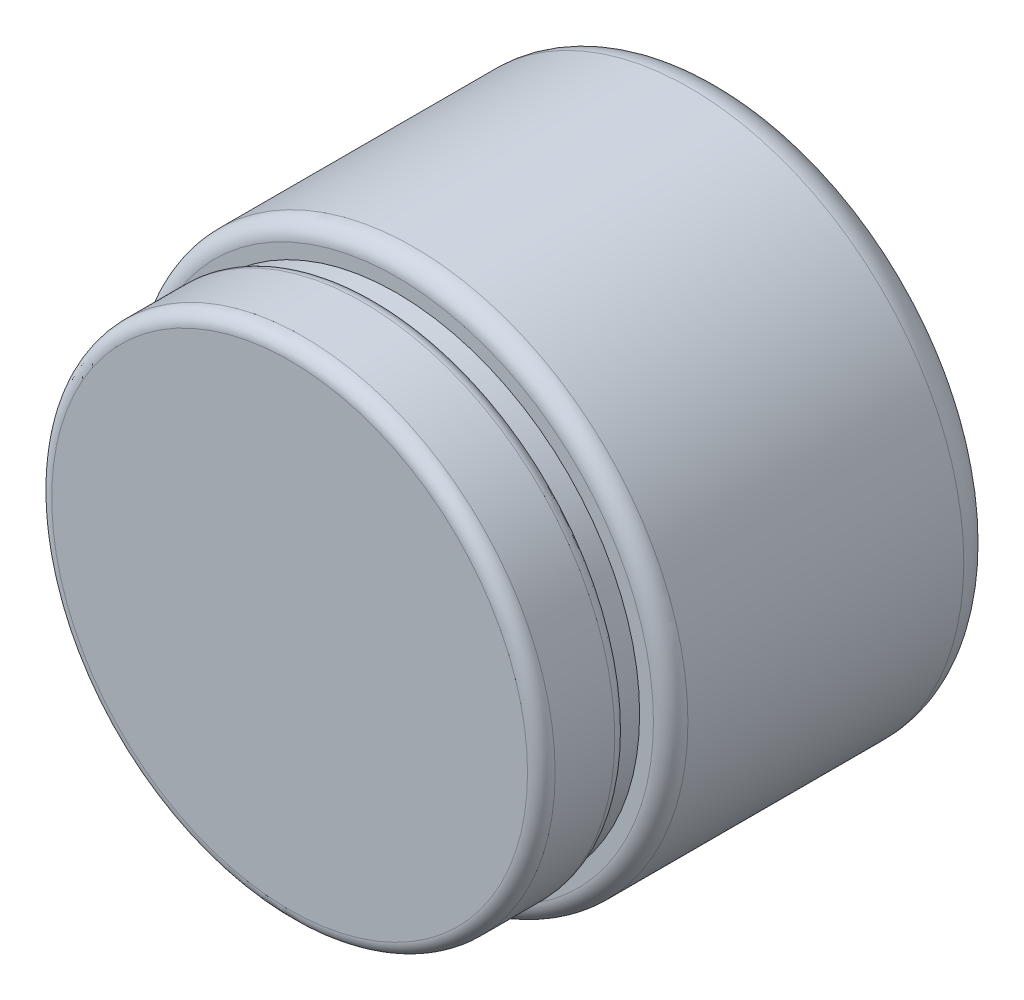
from build123d import *

# Parameters (mm, degrees)
SKETCH1_R           = 37.084
BOSS_EXTRUDE1_DEPTH = 12.7
SKETCH2_R           = 35.814
BOSS_EXTRUDE2_DEPTH = 3.048
SKETCH3_R           = 40.386
BOSS_EXTRUDE3_DEPTH = 48.26
FILLET1_R           = 2.54
FILLET2_R           = 5.08
FILLET3_R           = 2.032


with BuildPart() as part:
    # Sketch1 → Boss-Extrude1 (new body)
    with BuildSketch(Plane.XY):
        Circle(SKETCH1_R)
    extrude(amount=BOSS_EXTRUDE1_DEPTH)

    # Sketch2 → Boss-Extrude2 (add)
    with BuildSketch(Plane(origin=(0, 0, 0), x_dir=(-1, 0, 0), z_dir=(0, 0, -1))):
        with Locations(Location((0, 0, 0), (0, 0, 180))):
            Circle(SKETCH2_R)
    extrude(amount=BOSS_EXTRUDE2_DEPTH)

    # Sketch3 → Boss-Extrude3 (add)
    with BuildSketch(Plane(origin=(0, 0, -3.048), x_dir=(-1, 0, 0), z_dir=(0, 0, -1))):
        with Locations(Location((0, 0, 0), (0, 0, 180))):
            Circle(SKETCH3_R)
    extrude(amount=BOSS_EXTRUDE3_DEPTH)

    # Fillet1
    fillet1_edges = [part.edges().sort_by_distance(p)[0] for p in [
        (-40.386, 0, -3.048),
    ]]
    fillet(fillet1_edges, radius=FILLET1_R)

    # Fillet2
    fillet2_edges = [part.edges().sort_by_distance(p)[0] for p in [
        (-40.386, 0, -51.308),
    ]]
    fillet(fillet2_edges, radius=FILLET2_R)

    # Fillet3
    # the kernel refuses this fillet: 2.032 mm, written as the material it takes off along each edge
    with BuildSketch(Plane(origin=(0, 0, 0), x_dir=(1, 0, 0), z_dir=(0, -1, 0))) as fillet3_piece_1:
        with BuildLine():
            CenterArc((35.052, 1.883714416), FILLET3_R, 292.024312837, 67.975687163)
            Line((37.084, 1.883714416), (37.12464, 1.883714416))
            Line((37.12464, 1.883714416), (37.12464, 0))
            Line((37.12464, 0), (37.084, -0.04064))
            ThreePointArc((37.084, -0.04064), (36.449, -0.04064), (35.82924, -0.037674288))
            Line((35.82924, -0.037674288), (35.814, 0))
        make_face()
    revolve(axis=Axis((0, 0, 0), (0, 0, 1)), mode=Mode.SUBTRACT)
    with BuildSketch(Plane(origin=(0, 0, 12.7), x_dir=(1, 0, 0), z_dir=(0, -1, 0))) as fillet3_piece_2:
        with BuildLine():
            CenterArc((37.084 - FILLET3_R, -FILLET3_R), FILLET3_R, 0, 90)
            Line((37.084 - FILLET3_R, 0), (37.084 - FILLET3_R, FILLET3_R * 0.02))
            Line((37.084 - FILLET3_R, FILLET3_R * 0.02), (37.084 + FILLET3_R * 0.02, FILLET3_R * 0.02))
            Line((37.084 + FILLET3_R * 0.02, FILLET3_R * 0.02), (37.084 + FILLET3_R * 0.02, -FILLET3_R))
            Line((37.084 + FILLET3_R * 0.02, -FILLET3_R), (37.084, -FILLET3_R))
        make_face()
    revolve(axis=Axis((0, 0, 12.7), (0, 0, 1)), mode=Mode.SUBTRACT)


solid = part.part
